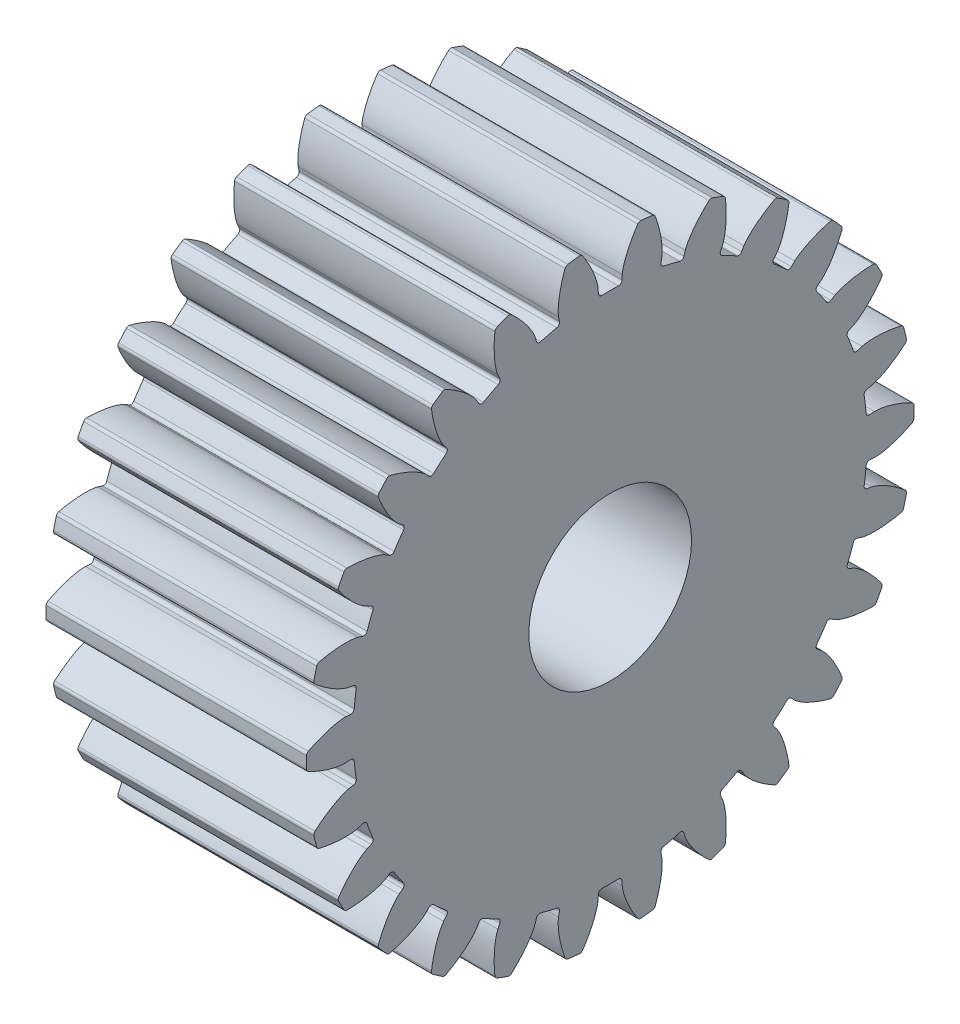
from build123d import *

# Parameters (mm, degrees)
SKETCH2_R                      = 14.816666667
SKETCH2_R_2                    = 3.96875
GEAR_WIDTH_EXTRUDE_DEPTH       = 12.7
GEAR_TOOTH_CUT_DEPTH           = 25.4
TOOTH_FILLETS_R                = 0.166158333
CIRPATTERN1_COUNT              = 26
CIRPATTERN1_COPY_1_DEPTH       = 25.4
CIRPATTERN1_COPY_2_DEPTH       = 25.4
CIRPATTERN1_COPY_3_DEPTH       = 25.4
CIRPATTERN1_COPY_4_DEPTH       = 25.4
CIRPATTERN1_COPY_5_DEPTH       = 25.4
CIRPATTERN1_COPY_6_DEPTH       = 25.4
CIRPATTERN1_COPY_7_DEPTH       = 25.4
CIRPATTERN1_COPY_8_DEPTH       = 25.4
CIRPATTERN1_COPY_9_DEPTH       = 25.4
CIRPATTERN1_COPY_10_DEPTH      = 25.4
CIRPATTERN1_COPY_11_DEPTH      = 25.4
CIRPATTERN1_COPY_12_DEPTH      = 25.4
CIRPATTERN1_COPY_13_DEPTH      = 25.4
CIRPATTERN1_COPY_14_DEPTH      = 25.4
CIRPATTERN1_COPY_15_DEPTH      = 25.4
CIRPATTERN1_COPY_16_DEPTH      = 25.4
CIRPATTERN1_COPY_17_DEPTH      = 25.4
CIRPATTERN1_COPY_18_DEPTH      = 25.4
CIRPATTERN1_COPY_19_DEPTH      = 25.4
CIRPATTERN1_COPY_20_DEPTH      = 25.4
CIRPATTERN1_COPY_21_DEPTH      = 25.4
CIRPATTERN1_COPY_22_DEPTH      = 25.4
CIRPATTERN1_COPY_23_DEPTH      = 25.4
CIRPATTERN1_COPY_24_DEPTH      = 25.4
CIRPATTERN1_COPY_25_DEPTH      = 25.4
TOOTH_FILLETS_OF_CIRPATTERN1_R = 0.166158333


with BuildPart() as part:
    # Sketch2 → Gear Width Extrude (new body)
    with BuildSketch(Plane.YZ):
        Circle(SKETCH2_R)
        Circle(SKETCH2_R_2, mode=Mode.SUBTRACT)
    extrude(amount=GEAR_WIDTH_EXTRUDE_DEPTH)

    # Sketch3 → Gear Tooth Cut (cut)
    with BuildSketch(Plane.YZ):
        with BuildLine():
            ThreePointArc((12.52086362, 0.570229012), (12.530596735, 0.28518834), (12.533841667, 0))
            Line((12.533841667, 0), (14.816666667, 0))
            ThreePointArc((14.816666667, 0), (14.79996166, 0.70338182), (14.749884306, 1.405177589))
            add(Edge.make_bspline(
                [(12.915217508, 0.588188798), (12.918208341, 0.588360522), (12.926591, 0.5889519), (12.952440381, 0.591486174), (13.003294161, 0.598476616), (13.065845165, 0.609963216), (13.137508857, 0.625896967), (13.206422051, 0.64341803), (13.265177715, 0.659725839), (13.323624717, 0.677227502), (13.381691149, 0.695773656), (13.451831714, 0.719550719), (13.535655857, 0.749883796), (13.633192126, 0.787986968), (13.743267873, 0.834322472), (13.854828898, 0.884873112), (13.964077164, 0.937345481), (14.073810457, 0.993489939), (14.179521744, 1.050028375), (14.288612776, 1.111944092), (14.388950715, 1.17071875), (14.500534436, 1.240082235), (14.590344265, 1.297086613), (14.682395145, 1.358891943), (14.72708899, 1.389403312), (14.749884306, 1.405177589)],
                knots=[0, 0, 0, 0, 0, 0.005376749, 0.015083688, 0.04661014, 0.092110526, 0.119476176, 0.146842496, 0.174208854, 0.201574956, 0.228941013, 0.256307345, 0.307035032, 0.361767352, 0.416499661, 0.471231937, 0.525964282, 0.580696616, 0.635428982, 0.690161387, 0.744893688, 0.799626082, 0.854358407, 0.909090914, 0.909090914, 0.909090914, 0.909090914, 0.909090914], degree=4))
            Line((12.915217508, 0.588188798), (12.52086362, 0.570229012))
        make_face()
    gear_tooth_cut = extrude(amount=GEAR_TOOTH_CUT_DEPTH, mode=Mode.SUBTRACT)

    # Gear Tooth Cut Mirror: Gear Tooth Cut across plane
    add(gear_tooth_cut.mirror(Plane(origin=(25.4, 0, 0), x_dir=(1, 0, 0), z_dir=(0, 0, 1))), mode=Mode.SUBTRACT)

    # Tooth Fillets
    tooth_fillets_edges = [part.edges().sort_by_distance(p)[0] for p in [
        (6.35, 14.749884306, 1.405177589),
        (6.35, 14.749884306, -1.405177589),
        (6.35, 12.52086362, 0.570229012),
        (6.35, 12.52086362, -0.570229012),
    ]]
    fillet(tooth_fillets_edges, radius=TOOTH_FILLETS_R)

    # CirPattern1: Gear Tooth Cut ×26 about axis
    cirpattern1_axis = Axis((0, 0, 0), (1, 0, 0))
    for i in range(1, CIRPATTERN1_COUNT):
        add(gear_tooth_cut.rotate(cirpattern1_axis, i * 360 / CIRPATTERN1_COUNT), mode=Mode.SUBTRACT)

    # CirPattern1 copy 1 sketch → CirPattern1 copy 1 (cut)
    with BuildSketch(Plane(origin=(0, 0, 0), x_dir=(0, 0.970941817426052, 0.23931566428755777), z_dir=(1, 0, 0))):
        with BuildLine():
            ThreePointArc((12.52086362, -0.570229012), (12.530596735, -0.28518834), (12.533841667, 0))
            Line((12.533841667, 0), (14.816666667, 0))
            ThreePointArc((14.816666667, 0), (14.79996166, -0.70338182), (14.749884306, -1.405177589))
            add(Edge.make_bspline(
                [(12.915217508, -0.588188798), (12.918208341, -0.588360522), (12.926591, -0.5889519), (12.952440381, -0.591486174), (13.003294161, -0.598476616), (13.065845165, -0.609963216), (13.137508857, -0.625896967), (13.206422051, -0.64341803), (13.265177715, -0.659725839), (13.323624717, -0.677227502), (13.381691149, -0.695773656), (13.451831714, -0.719550719), (13.535655857, -0.749883796), (13.633192126, -0.787986968), (13.743267873, -0.834322472), (13.854828898, -0.884873112), (13.964077164, -0.937345481), (14.073810457, -0.993489939), (14.179521744, -1.050028375), (14.288612776, -1.111944092), (14.388950715, -1.17071875), (14.500534436, -1.240082235), (14.590344265, -1.297086613), (14.682395145, -1.358891943), (14.72708899, -1.389403312), (14.749884306, -1.405177589)],
                knots=[0, 0, 0, 0, 0, 0.005376749, 0.015083688, 0.04661014, 0.092110526, 0.119476176, 0.146842496, 0.174208854, 0.201574956, 0.228941013, 0.256307345, 0.307035032, 0.361767352, 0.416499661, 0.471231937, 0.525964282, 0.580696616, 0.635428982, 0.690161387, 0.744893688, 0.799626082, 0.854358407, 0.909090914, 0.909090914, 0.909090914, 0.909090914, 0.909090914], degree=4))
            Line((12.915217508, -0.588188798), (12.52086362, -0.570229012))
        make_face()
    extrude(amount=CIRPATTERN1_COPY_1_DEPTH, mode=Mode.SUBTRACT)

    # CirPattern1 copy 2 sketch → CirPattern1 copy 2 (cut)
    with BuildSketch(Plane(origin=(0, 0, 0), x_dir=(0, 0.8854560256532099, 0.46472317204376856), z_dir=(1, 0, 0))):
        with BuildLine():
            ThreePointArc((12.52086362, -0.570229012), (12.530596735, -0.28518834), (12.533841667, 0))
            Line((12.533841667, 0), (14.816666667, 0))
            ThreePointArc((14.816666667, 0), (14.79996166, -0.70338182), (14.749884306, -1.405177589))
            add(Edge.make_bspline(
                [(12.915217508, -0.588188798), (12.918208341, -0.588360522), (12.926591, -0.5889519), (12.952440381, -0.591486174), (13.003294161, -0.598476616), (13.065845165, -0.609963216), (13.137508857, -0.625896967), (13.206422051, -0.64341803), (13.265177715, -0.659725839), (13.323624717, -0.677227502), (13.381691149, -0.695773656), (13.451831714, -0.719550719), (13.535655857, -0.749883796), (13.633192126, -0.787986968), (13.743267873, -0.834322472), (13.854828898, -0.884873112), (13.964077164, -0.937345481), (14.073810457, -0.993489939), (14.179521744, -1.050028375), (14.288612776, -1.111944092), (14.388950715, -1.17071875), (14.500534436, -1.240082235), (14.590344265, -1.297086613), (14.682395145, -1.358891943), (14.72708899, -1.389403312), (14.749884306, -1.405177589)],
                knots=[0, 0, 0, 0, 0, 0.005376749, 0.015083688, 0.04661014, 0.092110526, 0.119476176, 0.146842496, 0.174208854, 0.201574956, 0.228941013, 0.256307345, 0.307035032, 0.361767352, 0.416499661, 0.471231937, 0.525964282, 0.580696616, 0.635428982, 0.690161387, 0.744893688, 0.799626082, 0.854358407, 0.909090914, 0.909090914, 0.909090914, 0.909090914, 0.909090914], degree=4))
            Line((12.915217508, -0.588188798), (12.52086362, -0.570229012))
        make_face()
    extrude(amount=CIRPATTERN1_COPY_2_DEPTH, mode=Mode.SUBTRACT)

    # CirPattern1 copy 3 sketch → CirPattern1 copy 3 (cut)
    with BuildSketch(Plane(origin=(0, 0, 0), x_dir=(0, 0.7485107481711011, 0.6631226582407952), z_dir=(1, 0, 0))):
        with BuildLine():
            ThreePointArc((12.52086362, -0.570229012), (12.530596735, -0.28518834), (12.533841667, 0))
            Line((12.533841667, 0), (14.816666667, 0))
            ThreePointArc((14.816666667, 0), (14.79996166, -0.70338182), (14.749884306, -1.405177589))
            add(Edge.make_bspline(
                [(12.915217508, -0.588188798), (12.918208341, -0.588360522), (12.926591, -0.5889519), (12.952440381, -0.591486174), (13.003294161, -0.598476616), (13.065845165, -0.609963216), (13.137508857, -0.625896967), (13.206422051, -0.64341803), (13.265177715, -0.659725839), (13.323624717, -0.677227502), (13.381691149, -0.695773656), (13.451831714, -0.719550719), (13.535655857, -0.749883796), (13.633192126, -0.787986968), (13.743267873, -0.834322472), (13.854828898, -0.884873112), (13.964077164, -0.937345481), (14.073810457, -0.993489939), (14.179521744, -1.050028375), (14.288612776, -1.111944092), (14.388950715, -1.17071875), (14.500534436, -1.240082235), (14.590344265, -1.297086613), (14.682395145, -1.358891943), (14.72708899, -1.389403312), (14.749884306, -1.405177589)],
                knots=[0, 0, 0, 0, 0, 0.005376749, 0.015083688, 0.04661014, 0.092110526, 0.119476176, 0.146842496, 0.174208854, 0.201574956, 0.228941013, 0.256307345, 0.307035032, 0.361767352, 0.416499661, 0.471231937, 0.525964282, 0.580696616, 0.635428982, 0.690161387, 0.744893688, 0.799626082, 0.854358407, 0.909090914, 0.909090914, 0.909090914, 0.909090914, 0.909090914], degree=4))
            Line((12.915217508, -0.588188798), (12.52086362, -0.570229012))
        make_face()
    extrude(amount=CIRPATTERN1_COPY_3_DEPTH, mode=Mode.SUBTRACT)

    # CirPattern1 copy 4 sketch → CirPattern1 copy 4 (cut)
    with BuildSketch(Plane(origin=(0, 0, 0), x_dir=(0, 0.5680647467311558, 0.8229838658936565), z_dir=(1, 0, 0))):
        with BuildLine():
            ThreePointArc((12.52086362, -0.570229012), (12.530596735, -0.28518834), (12.533841667, 0))
            Line((12.533841667, 0), (14.816666667, 0))
            ThreePointArc((14.816666667, 0), (14.79996166, -0.70338182), (14.749884306, -1.405177589))
            add(Edge.make_bspline(
                [(12.915217508, -0.588188798), (12.918208341, -0.588360522), (12.926591, -0.5889519), (12.952440381, -0.591486174), (13.003294161, -0.598476616), (13.065845165, -0.609963216), (13.137508857, -0.625896967), (13.206422051, -0.64341803), (13.265177715, -0.659725839), (13.323624717, -0.677227502), (13.381691149, -0.695773656), (13.451831714, -0.719550719), (13.535655857, -0.749883796), (13.633192126, -0.787986968), (13.743267873, -0.834322472), (13.854828898, -0.884873112), (13.964077164, -0.937345481), (14.073810457, -0.993489939), (14.179521744, -1.050028375), (14.288612776, -1.111944092), (14.388950715, -1.17071875), (14.500534436, -1.240082235), (14.590344265, -1.297086613), (14.682395145, -1.358891943), (14.72708899, -1.389403312), (14.749884306, -1.405177589)],
                knots=[0, 0, 0, 0, 0, 0.005376749, 0.015083688, 0.04661014, 0.092110526, 0.119476176, 0.146842496, 0.174208854, 0.201574956, 0.228941013, 0.256307345, 0.307035032, 0.361767352, 0.416499661, 0.471231937, 0.525964282, 0.580696616, 0.635428982, 0.690161387, 0.744893688, 0.799626082, 0.854358407, 0.909090914, 0.909090914, 0.909090914, 0.909090914, 0.909090914], degree=4))
            Line((12.915217508, -0.588188798), (12.52086362, -0.570229012))
        make_face()
    extrude(amount=CIRPATTERN1_COPY_4_DEPTH, mode=Mode.SUBTRACT)

    # CirPattern1 copy 5 sketch → CirPattern1 copy 5 (cut)
    with BuildSketch(Plane(origin=(0, 0, 0), x_dir=(0, 0.3546048870425358, 0.9350162426854147), z_dir=(1, 0, 0))):
        with BuildLine():
            ThreePointArc((12.52086362, -0.570229012), (12.530596735, -0.28518834), (12.533841667, 0))
            Line((12.533841667, 0), (14.816666667, 0))
            ThreePointArc((14.816666667, 0), (14.79996166, -0.70338182), (14.749884306, -1.405177589))
            add(Edge.make_bspline(
                [(12.915217508, -0.588188798), (12.918208341, -0.588360522), (12.926591, -0.5889519), (12.952440381, -0.591486174), (13.003294161, -0.598476616), (13.065845165, -0.609963216), (13.137508857, -0.625896967), (13.206422051, -0.64341803), (13.265177715, -0.659725839), (13.323624717, -0.677227502), (13.381691149, -0.695773656), (13.451831714, -0.719550719), (13.535655857, -0.749883796), (13.633192126, -0.787986968), (13.743267873, -0.834322472), (13.854828898, -0.884873112), (13.964077164, -0.937345481), (14.073810457, -0.993489939), (14.179521744, -1.050028375), (14.288612776, -1.111944092), (14.388950715, -1.17071875), (14.500534436, -1.240082235), (14.590344265, -1.297086613), (14.682395145, -1.358891943), (14.72708899, -1.389403312), (14.749884306, -1.405177589)],
                knots=[0, 0, 0, 0, 0, 0.005376749, 0.015083688, 0.04661014, 0.092110526, 0.119476176, 0.146842496, 0.174208854, 0.201574956, 0.228941013, 0.256307345, 0.307035032, 0.361767352, 0.416499661, 0.471231937, 0.525964282, 0.580696616, 0.635428982, 0.690161387, 0.744893688, 0.799626082, 0.854358407, 0.909090914, 0.909090914, 0.909090914, 0.909090914, 0.909090914], degree=4))
            Line((12.915217508, -0.588188798), (12.52086362, -0.570229012))
        make_face()
    extrude(amount=CIRPATTERN1_COPY_5_DEPTH, mode=Mode.SUBTRACT)

    # CirPattern1 copy 6 sketch → CirPattern1 copy 6 (cut)
    with BuildSketch(Plane(origin=(0, 0, 0), x_dir=(0, 0.120536680255323, 0.992708874098054), z_dir=(1, 0, 0))):
        with BuildLine():
            ThreePointArc((12.52086362, -0.570229012), (12.530596735, -0.28518834), (12.533841667, 0))
            Line((12.533841667, 0), (14.816666667, 0))
            ThreePointArc((14.816666667, 0), (14.79996166, -0.70338182), (14.749884306, -1.405177589))
            add(Edge.make_bspline(
                [(12.915217508, -0.588188798), (12.918208341, -0.588360522), (12.926591, -0.5889519), (12.952440381, -0.591486174), (13.003294161, -0.598476616), (13.065845165, -0.609963216), (13.137508857, -0.625896967), (13.206422051, -0.64341803), (13.265177715, -0.659725839), (13.323624717, -0.677227502), (13.381691149, -0.695773656), (13.451831714, -0.719550719), (13.535655857, -0.749883796), (13.633192126, -0.787986968), (13.743267873, -0.834322472), (13.854828898, -0.884873112), (13.964077164, -0.937345481), (14.073810457, -0.993489939), (14.179521744, -1.050028375), (14.288612776, -1.111944092), (14.388950715, -1.17071875), (14.500534436, -1.240082235), (14.590344265, -1.297086613), (14.682395145, -1.358891943), (14.72708899, -1.389403312), (14.749884306, -1.405177589)],
                knots=[0, 0, 0, 0, 0, 0.005376749, 0.015083688, 0.04661014, 0.092110526, 0.119476176, 0.146842496, 0.174208854, 0.201574956, 0.228941013, 0.256307345, 0.307035032, 0.361767352, 0.416499661, 0.471231937, 0.525964282, 0.580696616, 0.635428982, 0.690161387, 0.744893688, 0.799626082, 0.854358407, 0.909090914, 0.909090914, 0.909090914, 0.909090914, 0.909090914], degree=4))
            Line((12.915217508, -0.588188798), (12.52086362, -0.570229012))
        make_face()
    extrude(amount=CIRPATTERN1_COPY_6_DEPTH, mode=Mode.SUBTRACT)

    # CirPattern1 copy 7 sketch → CirPattern1 copy 7 (cut)
    with BuildSketch(Plane(origin=(0, 0, 0), x_dir=(0, -0.1205366802553231, 0.992708874098054), z_dir=(1, 0, 0))):
        with BuildLine():
            ThreePointArc((12.52086362, -0.570229012), (12.530596735, -0.28518834), (12.533841667, 0))
            Line((12.533841667, 0), (14.816666667, 0))
            ThreePointArc((14.816666667, 0), (14.79996166, -0.70338182), (14.749884306, -1.405177589))
            add(Edge.make_bspline(
                [(12.915217508, -0.588188798), (12.918208341, -0.588360522), (12.926591, -0.5889519), (12.952440381, -0.591486174), (13.003294161, -0.598476616), (13.065845165, -0.609963216), (13.137508857, -0.625896967), (13.206422051, -0.64341803), (13.265177715, -0.659725839), (13.323624717, -0.677227502), (13.381691149, -0.695773656), (13.451831714, -0.719550719), (13.535655857, -0.749883796), (13.633192126, -0.787986968), (13.743267873, -0.834322472), (13.854828898, -0.884873112), (13.964077164, -0.937345481), (14.073810457, -0.993489939), (14.179521744, -1.050028375), (14.288612776, -1.111944092), (14.388950715, -1.17071875), (14.500534436, -1.240082235), (14.590344265, -1.297086613), (14.682395145, -1.358891943), (14.72708899, -1.389403312), (14.749884306, -1.405177589)],
                knots=[0, 0, 0, 0, 0, 0.005376749, 0.015083688, 0.04661014, 0.092110526, 0.119476176, 0.146842496, 0.174208854, 0.201574956, 0.228941013, 0.256307345, 0.307035032, 0.361767352, 0.416499661, 0.471231937, 0.525964282, 0.580696616, 0.635428982, 0.690161387, 0.744893688, 0.799626082, 0.854358407, 0.909090914, 0.909090914, 0.909090914, 0.909090914, 0.909090914], degree=4))
            Line((12.915217508, -0.588188798), (12.52086362, -0.570229012))
        make_face()
    extrude(amount=CIRPATTERN1_COPY_7_DEPTH, mode=Mode.SUBTRACT)

    # CirPattern1 copy 8 sketch → CirPattern1 copy 8 (cut)
    with BuildSketch(Plane(origin=(0, 0, 0), x_dir=(0, -0.3546048870425357, 0.9350162426854148), z_dir=(1, 0, 0))):
        with BuildLine():
            ThreePointArc((12.52086362, -0.570229012), (12.530596735, -0.28518834), (12.533841667, 0))
            Line((12.533841667, 0), (14.816666667, 0))
            ThreePointArc((14.816666667, 0), (14.79996166, -0.70338182), (14.749884306, -1.405177589))
            add(Edge.make_bspline(
                [(12.915217508, -0.588188798), (12.918208341, -0.588360522), (12.926591, -0.5889519), (12.952440381, -0.591486174), (13.003294161, -0.598476616), (13.065845165, -0.609963216), (13.137508857, -0.625896967), (13.206422051, -0.64341803), (13.265177715, -0.659725839), (13.323624717, -0.677227502), (13.381691149, -0.695773656), (13.451831714, -0.719550719), (13.535655857, -0.749883796), (13.633192126, -0.787986968), (13.743267873, -0.834322472), (13.854828898, -0.884873112), (13.964077164, -0.937345481), (14.073810457, -0.993489939), (14.179521744, -1.050028375), (14.288612776, -1.111944092), (14.388950715, -1.17071875), (14.500534436, -1.240082235), (14.590344265, -1.297086613), (14.682395145, -1.358891943), (14.72708899, -1.389403312), (14.749884306, -1.405177589)],
                knots=[0, 0, 0, 0, 0, 0.005376749, 0.015083688, 0.04661014, 0.092110526, 0.119476176, 0.146842496, 0.174208854, 0.201574956, 0.228941013, 0.256307345, 0.307035032, 0.361767352, 0.416499661, 0.471231937, 0.525964282, 0.580696616, 0.635428982, 0.690161387, 0.744893688, 0.799626082, 0.854358407, 0.909090914, 0.909090914, 0.909090914, 0.909090914, 0.909090914], degree=4))
            Line((12.915217508, -0.588188798), (12.52086362, -0.570229012))
        make_face()
    extrude(amount=CIRPATTERN1_COPY_8_DEPTH, mode=Mode.SUBTRACT)

    # CirPattern1 copy 9 sketch → CirPattern1 copy 9 (cut)
    with BuildSketch(Plane(origin=(0, 0, 0), x_dir=(0, -0.5680647467311557, 0.8229838658936565), z_dir=(1, 0, 0))):
        with BuildLine():
            ThreePointArc((12.52086362, -0.570229012), (12.530596735, -0.28518834), (12.533841667, 0))
            Line((12.533841667, 0), (14.816666667, 0))
            ThreePointArc((14.816666667, 0), (14.79996166, -0.70338182), (14.749884306, -1.405177589))
            add(Edge.make_bspline(
                [(12.915217508, -0.588188798), (12.918208341, -0.588360522), (12.926591, -0.5889519), (12.952440381, -0.591486174), (13.003294161, -0.598476616), (13.065845165, -0.609963216), (13.137508857, -0.625896967), (13.206422051, -0.64341803), (13.265177715, -0.659725839), (13.323624717, -0.677227502), (13.381691149, -0.695773656), (13.451831714, -0.719550719), (13.535655857, -0.749883796), (13.633192126, -0.787986968), (13.743267873, -0.834322472), (13.854828898, -0.884873112), (13.964077164, -0.937345481), (14.073810457, -0.993489939), (14.179521744, -1.050028375), (14.288612776, -1.111944092), (14.388950715, -1.17071875), (14.500534436, -1.240082235), (14.590344265, -1.297086613), (14.682395145, -1.358891943), (14.72708899, -1.389403312), (14.749884306, -1.405177589)],
                knots=[0, 0, 0, 0, 0, 0.005376749, 0.015083688, 0.04661014, 0.092110526, 0.119476176, 0.146842496, 0.174208854, 0.201574956, 0.228941013, 0.256307345, 0.307035032, 0.361767352, 0.416499661, 0.471231937, 0.525964282, 0.580696616, 0.635428982, 0.690161387, 0.744893688, 0.799626082, 0.854358407, 0.909090914, 0.909090914, 0.909090914, 0.909090914, 0.909090914], degree=4))
            Line((12.915217508, -0.588188798), (12.52086362, -0.570229012))
        make_face()
    extrude(amount=CIRPATTERN1_COPY_9_DEPTH, mode=Mode.SUBTRACT)

    # CirPattern1 copy 10 sketch → CirPattern1 copy 10 (cut)
    with BuildSketch(Plane(origin=(0, 0, 0), x_dir=(0, -0.7485107481711009, 0.6631226582407955), z_dir=(1, 0, 0))):
        with BuildLine():
            ThreePointArc((12.52086362, -0.570229012), (12.530596735, -0.28518834), (12.533841667, 0))
            Line((12.533841667, 0), (14.816666667, 0))
            ThreePointArc((14.816666667, 0), (14.79996166, -0.70338182), (14.749884306, -1.405177589))
            add(Edge.make_bspline(
                [(12.915217508, -0.588188798), (12.918208341, -0.588360522), (12.926591, -0.5889519), (12.952440381, -0.591486174), (13.003294161, -0.598476616), (13.065845165, -0.609963216), (13.137508857, -0.625896967), (13.206422051, -0.64341803), (13.265177715, -0.659725839), (13.323624717, -0.677227502), (13.381691149, -0.695773656), (13.451831714, -0.719550719), (13.535655857, -0.749883796), (13.633192126, -0.787986968), (13.743267873, -0.834322472), (13.854828898, -0.884873112), (13.964077164, -0.937345481), (14.073810457, -0.993489939), (14.179521744, -1.050028375), (14.288612776, -1.111944092), (14.388950715, -1.17071875), (14.500534436, -1.240082235), (14.590344265, -1.297086613), (14.682395145, -1.358891943), (14.72708899, -1.389403312), (14.749884306, -1.405177589)],
                knots=[0, 0, 0, 0, 0, 0.005376749, 0.015083688, 0.04661014, 0.092110526, 0.119476176, 0.146842496, 0.174208854, 0.201574956, 0.228941013, 0.256307345, 0.307035032, 0.361767352, 0.416499661, 0.471231937, 0.525964282, 0.580696616, 0.635428982, 0.690161387, 0.744893688, 0.799626082, 0.854358407, 0.909090914, 0.909090914, 0.909090914, 0.909090914, 0.909090914], degree=4))
            Line((12.915217508, -0.588188798), (12.52086362, -0.570229012))
        make_face()
    extrude(amount=CIRPATTERN1_COPY_10_DEPTH, mode=Mode.SUBTRACT)

    # CirPattern1 copy 11 sketch → CirPattern1 copy 11 (cut)
    with BuildSketch(Plane(origin=(0, 0, 0), x_dir=(0, -0.88545602565321, 0.4647231720437683), z_dir=(1, 0, 0))):
        with BuildLine():
            ThreePointArc((12.52086362, -0.570229012), (12.530596735, -0.28518834), (12.533841667, 0))
            Line((12.533841667, 0), (14.816666667, 0))
            ThreePointArc((14.816666667, 0), (14.79996166, -0.70338182), (14.749884306, -1.405177589))
            add(Edge.make_bspline(
                [(12.915217508, -0.588188798), (12.918208341, -0.588360522), (12.926591, -0.5889519), (12.952440381, -0.591486174), (13.003294161, -0.598476616), (13.065845165, -0.609963216), (13.137508857, -0.625896967), (13.206422051, -0.64341803), (13.265177715, -0.659725839), (13.323624717, -0.677227502), (13.381691149, -0.695773656), (13.451831714, -0.719550719), (13.535655857, -0.749883796), (13.633192126, -0.787986968), (13.743267873, -0.834322472), (13.854828898, -0.884873112), (13.964077164, -0.937345481), (14.073810457, -0.993489939), (14.179521744, -1.050028375), (14.288612776, -1.111944092), (14.388950715, -1.17071875), (14.500534436, -1.240082235), (14.590344265, -1.297086613), (14.682395145, -1.358891943), (14.72708899, -1.389403312), (14.749884306, -1.405177589)],
                knots=[0, 0, 0, 0, 0, 0.005376749, 0.015083688, 0.04661014, 0.092110526, 0.119476176, 0.146842496, 0.174208854, 0.201574956, 0.228941013, 0.256307345, 0.307035032, 0.361767352, 0.416499661, 0.471231937, 0.525964282, 0.580696616, 0.635428982, 0.690161387, 0.744893688, 0.799626082, 0.854358407, 0.909090914, 0.909090914, 0.909090914, 0.909090914, 0.909090914], degree=4))
            Line((12.915217508, -0.588188798), (12.52086362, -0.570229012))
        make_face()
    extrude(amount=CIRPATTERN1_COPY_11_DEPTH, mode=Mode.SUBTRACT)

    # CirPattern1 copy 12 sketch → CirPattern1 copy 12 (cut)
    with BuildSketch(Plane(origin=(0, 0, 0), x_dir=(0, -0.970941817426052, 0.23931566428755768), z_dir=(1, 0, 0))):
        with BuildLine():
            ThreePointArc((12.52086362, -0.570229012), (12.530596735, -0.28518834), (12.533841667, 0))
            Line((12.533841667, 0), (14.816666667, 0))
            ThreePointArc((14.816666667, 0), (14.79996166, -0.70338182), (14.749884306, -1.405177589))
            add(Edge.make_bspline(
                [(12.915217508, -0.588188798), (12.918208341, -0.588360522), (12.926591, -0.5889519), (12.952440381, -0.591486174), (13.003294161, -0.598476616), (13.065845165, -0.609963216), (13.137508857, -0.625896967), (13.206422051, -0.64341803), (13.265177715, -0.659725839), (13.323624717, -0.677227502), (13.381691149, -0.695773656), (13.451831714, -0.719550719), (13.535655857, -0.749883796), (13.633192126, -0.787986968), (13.743267873, -0.834322472), (13.854828898, -0.884873112), (13.964077164, -0.937345481), (14.073810457, -0.993489939), (14.179521744, -1.050028375), (14.288612776, -1.111944092), (14.388950715, -1.17071875), (14.500534436, -1.240082235), (14.590344265, -1.297086613), (14.682395145, -1.358891943), (14.72708899, -1.389403312), (14.749884306, -1.405177589)],
                knots=[0, 0, 0, 0, 0, 0.005376749, 0.015083688, 0.04661014, 0.092110526, 0.119476176, 0.146842496, 0.174208854, 0.201574956, 0.228941013, 0.256307345, 0.307035032, 0.361767352, 0.416499661, 0.471231937, 0.525964282, 0.580696616, 0.635428982, 0.690161387, 0.744893688, 0.799626082, 0.854358407, 0.909090914, 0.909090914, 0.909090914, 0.909090914, 0.909090914], degree=4))
            Line((12.915217508, -0.588188798), (12.52086362, -0.570229012))
        make_face()
    extrude(amount=CIRPATTERN1_COPY_12_DEPTH, mode=Mode.SUBTRACT)

    # CirPattern1 copy 13 sketch → CirPattern1 copy 13 (cut)
    with BuildSketch(Plane(origin=(0, 0, 0), x_dir=(0, -1, 0), z_dir=(1, 0, 0))):
        with BuildLine():
            ThreePointArc((12.52086362, -0.570229012), (12.530596735, -0.28518834), (12.533841667, 0))
            Line((12.533841667, 0), (14.816666667, 0))
            ThreePointArc((14.816666667, 0), (14.79996166, -0.70338182), (14.749884306, -1.405177589))
            add(Edge.make_bspline(
                [(12.915217508, -0.588188798), (12.918208341, -0.588360522), (12.926591, -0.5889519), (12.952440381, -0.591486174), (13.003294161, -0.598476616), (13.065845165, -0.609963216), (13.137508857, -0.625896967), (13.206422051, -0.64341803), (13.265177715, -0.659725839), (13.323624717, -0.677227502), (13.381691149, -0.695773656), (13.451831714, -0.719550719), (13.535655857, -0.749883796), (13.633192126, -0.787986968), (13.743267873, -0.834322472), (13.854828898, -0.884873112), (13.964077164, -0.937345481), (14.073810457, -0.993489939), (14.179521744, -1.050028375), (14.288612776, -1.111944092), (14.388950715, -1.17071875), (14.500534436, -1.240082235), (14.590344265, -1.297086613), (14.682395145, -1.358891943), (14.72708899, -1.389403312), (14.749884306, -1.405177589)],
                knots=[0, 0, 0, 0, 0, 0.005376749, 0.015083688, 0.04661014, 0.092110526, 0.119476176, 0.146842496, 0.174208854, 0.201574956, 0.228941013, 0.256307345, 0.307035032, 0.361767352, 0.416499661, 0.471231937, 0.525964282, 0.580696616, 0.635428982, 0.690161387, 0.744893688, 0.799626082, 0.854358407, 0.909090914, 0.909090914, 0.909090914, 0.909090914, 0.909090914], degree=4))
            Line((12.915217508, -0.588188798), (12.52086362, -0.570229012))
        make_face()
    extrude(amount=CIRPATTERN1_COPY_13_DEPTH, mode=Mode.SUBTRACT)

    # CirPattern1 copy 14 sketch → CirPattern1 copy 14 (cut)
    with BuildSketch(Plane(origin=(0, 0, 0), x_dir=(0, -0.970941817426052, -0.23931566428755788), z_dir=(1, 0, 0))):
        with BuildLine():
            ThreePointArc((12.52086362, -0.570229012), (12.530596735, -0.28518834), (12.533841667, 0))
            Line((12.533841667, 0), (14.816666667, 0))
            ThreePointArc((14.816666667, 0), (14.79996166, -0.70338182), (14.749884306, -1.405177589))
            add(Edge.make_bspline(
                [(12.915217508, -0.588188798), (12.918208341, -0.588360522), (12.926591, -0.5889519), (12.952440381, -0.591486174), (13.003294161, -0.598476616), (13.065845165, -0.609963216), (13.137508857, -0.625896967), (13.206422051, -0.64341803), (13.265177715, -0.659725839), (13.323624717, -0.677227502), (13.381691149, -0.695773656), (13.451831714, -0.719550719), (13.535655857, -0.749883796), (13.633192126, -0.787986968), (13.743267873, -0.834322472), (13.854828898, -0.884873112), (13.964077164, -0.937345481), (14.073810457, -0.993489939), (14.179521744, -1.050028375), (14.288612776, -1.111944092), (14.388950715, -1.17071875), (14.500534436, -1.240082235), (14.590344265, -1.297086613), (14.682395145, -1.358891943), (14.72708899, -1.389403312), (14.749884306, -1.405177589)],
                knots=[0, 0, 0, 0, 0, 0.005376749, 0.015083688, 0.04661014, 0.092110526, 0.119476176, 0.146842496, 0.174208854, 0.201574956, 0.228941013, 0.256307345, 0.307035032, 0.361767352, 0.416499661, 0.471231937, 0.525964282, 0.580696616, 0.635428982, 0.690161387, 0.744893688, 0.799626082, 0.854358407, 0.909090914, 0.909090914, 0.909090914, 0.909090914, 0.909090914], degree=4))
            Line((12.915217508, -0.588188798), (12.52086362, -0.570229012))
        make_face()
    extrude(amount=CIRPATTERN1_COPY_14_DEPTH, mode=Mode.SUBTRACT)

    # CirPattern1 copy 15 sketch → CirPattern1 copy 15 (cut)
    with BuildSketch(Plane(origin=(0, 0, 0), x_dir=(0, -0.8854560256532097, -0.46472317204376884), z_dir=(1, 0, 0))):
        with BuildLine():
            ThreePointArc((12.52086362, -0.570229012), (12.530596735, -0.28518834), (12.533841667, 0))
            Line((12.533841667, 0), (14.816666667, 0))
            ThreePointArc((14.816666667, 0), (14.79996166, -0.70338182), (14.749884306, -1.405177589))
            add(Edge.make_bspline(
                [(12.915217508, -0.588188798), (12.918208341, -0.588360522), (12.926591, -0.5889519), (12.952440381, -0.591486174), (13.003294161, -0.598476616), (13.065845165, -0.609963216), (13.137508857, -0.625896967), (13.206422051, -0.64341803), (13.265177715, -0.659725839), (13.323624717, -0.677227502), (13.381691149, -0.695773656), (13.451831714, -0.719550719), (13.535655857, -0.749883796), (13.633192126, -0.787986968), (13.743267873, -0.834322472), (13.854828898, -0.884873112), (13.964077164, -0.937345481), (14.073810457, -0.993489939), (14.179521744, -1.050028375), (14.288612776, -1.111944092), (14.388950715, -1.17071875), (14.500534436, -1.240082235), (14.590344265, -1.297086613), (14.682395145, -1.358891943), (14.72708899, -1.389403312), (14.749884306, -1.405177589)],
                knots=[0, 0, 0, 0, 0, 0.005376749, 0.015083688, 0.04661014, 0.092110526, 0.119476176, 0.146842496, 0.174208854, 0.201574956, 0.228941013, 0.256307345, 0.307035032, 0.361767352, 0.416499661, 0.471231937, 0.525964282, 0.580696616, 0.635428982, 0.690161387, 0.744893688, 0.799626082, 0.854358407, 0.909090914, 0.909090914, 0.909090914, 0.909090914, 0.909090914], degree=4))
            Line((12.915217508, -0.588188798), (12.52086362, -0.570229012))
        make_face()
    extrude(amount=CIRPATTERN1_COPY_15_DEPTH, mode=Mode.SUBTRACT)

    # CirPattern1 copy 16 sketch → CirPattern1 copy 16 (cut)
    with BuildSketch(Plane(origin=(0, 0, 0), x_dir=(0, -0.748510748171101, -0.6631226582407953), z_dir=(1, 0, 0))):
        with BuildLine():
            ThreePointArc((12.52086362, -0.570229012), (12.530596735, -0.28518834), (12.533841667, 0))
            Line((12.533841667, 0), (14.816666667, 0))
            ThreePointArc((14.816666667, 0), (14.79996166, -0.70338182), (14.749884306, -1.405177589))
            add(Edge.make_bspline(
                [(12.915217508, -0.588188798), (12.918208341, -0.588360522), (12.926591, -0.5889519), (12.952440381, -0.591486174), (13.003294161, -0.598476616), (13.065845165, -0.609963216), (13.137508857, -0.625896967), (13.206422051, -0.64341803), (13.265177715, -0.659725839), (13.323624717, -0.677227502), (13.381691149, -0.695773656), (13.451831714, -0.719550719), (13.535655857, -0.749883796), (13.633192126, -0.787986968), (13.743267873, -0.834322472), (13.854828898, -0.884873112), (13.964077164, -0.937345481), (14.073810457, -0.993489939), (14.179521744, -1.050028375), (14.288612776, -1.111944092), (14.388950715, -1.17071875), (14.500534436, -1.240082235), (14.590344265, -1.297086613), (14.682395145, -1.358891943), (14.72708899, -1.389403312), (14.749884306, -1.405177589)],
                knots=[0, 0, 0, 0, 0, 0.005376749, 0.015083688, 0.04661014, 0.092110526, 0.119476176, 0.146842496, 0.174208854, 0.201574956, 0.228941013, 0.256307345, 0.307035032, 0.361767352, 0.416499661, 0.471231937, 0.525964282, 0.580696616, 0.635428982, 0.690161387, 0.744893688, 0.799626082, 0.854358407, 0.909090914, 0.909090914, 0.909090914, 0.909090914, 0.909090914], degree=4))
            Line((12.915217508, -0.588188798), (12.52086362, -0.570229012))
        make_face()
    extrude(amount=CIRPATTERN1_COPY_16_DEPTH, mode=Mode.SUBTRACT)

    # CirPattern1 copy 17 sketch → CirPattern1 copy 17 (cut)
    with BuildSketch(Plane(origin=(0, 0, 0), x_dir=(0, -0.5680647467311559, -0.8229838658936564), z_dir=(1, 0, 0))):
        with BuildLine():
            ThreePointArc((12.52086362, -0.570229012), (12.530596735, -0.28518834), (12.533841667, 0))
            Line((12.533841667, 0), (14.816666667, 0))
            ThreePointArc((14.816666667, 0), (14.79996166, -0.70338182), (14.749884306, -1.405177589))
            add(Edge.make_bspline(
                [(12.915217508, -0.588188798), (12.918208341, -0.588360522), (12.926591, -0.5889519), (12.952440381, -0.591486174), (13.003294161, -0.598476616), (13.065845165, -0.609963216), (13.137508857, -0.625896967), (13.206422051, -0.64341803), (13.265177715, -0.659725839), (13.323624717, -0.677227502), (13.381691149, -0.695773656), (13.451831714, -0.719550719), (13.535655857, -0.749883796), (13.633192126, -0.787986968), (13.743267873, -0.834322472), (13.854828898, -0.884873112), (13.964077164, -0.937345481), (14.073810457, -0.993489939), (14.179521744, -1.050028375), (14.288612776, -1.111944092), (14.388950715, -1.17071875), (14.500534436, -1.240082235), (14.590344265, -1.297086613), (14.682395145, -1.358891943), (14.72708899, -1.389403312), (14.749884306, -1.405177589)],
                knots=[0, 0, 0, 0, 0, 0.005376749, 0.015083688, 0.04661014, 0.092110526, 0.119476176, 0.146842496, 0.174208854, 0.201574956, 0.228941013, 0.256307345, 0.307035032, 0.361767352, 0.416499661, 0.471231937, 0.525964282, 0.580696616, 0.635428982, 0.690161387, 0.744893688, 0.799626082, 0.854358407, 0.909090914, 0.909090914, 0.909090914, 0.909090914, 0.909090914], degree=4))
            Line((12.915217508, -0.588188798), (12.52086362, -0.570229012))
        make_face()
    extrude(amount=CIRPATTERN1_COPY_17_DEPTH, mode=Mode.SUBTRACT)

    # CirPattern1 copy 18 sketch → CirPattern1 copy 18 (cut)
    with BuildSketch(Plane(origin=(0, 0, 0), x_dir=(0, -0.3546048870425359, -0.9350162426854147), z_dir=(1, 0, 0))):
        with BuildLine():
            ThreePointArc((12.52086362, -0.570229012), (12.530596735, -0.28518834), (12.533841667, 0))
            Line((12.533841667, 0), (14.816666667, 0))
            ThreePointArc((14.816666667, 0), (14.79996166, -0.70338182), (14.749884306, -1.405177589))
            add(Edge.make_bspline(
                [(12.915217508, -0.588188798), (12.918208341, -0.588360522), (12.926591, -0.5889519), (12.952440381, -0.591486174), (13.003294161, -0.598476616), (13.065845165, -0.609963216), (13.137508857, -0.625896967), (13.206422051, -0.64341803), (13.265177715, -0.659725839), (13.323624717, -0.677227502), (13.381691149, -0.695773656), (13.451831714, -0.719550719), (13.535655857, -0.749883796), (13.633192126, -0.787986968), (13.743267873, -0.834322472), (13.854828898, -0.884873112), (13.964077164, -0.937345481), (14.073810457, -0.993489939), (14.179521744, -1.050028375), (14.288612776, -1.111944092), (14.388950715, -1.17071875), (14.500534436, -1.240082235), (14.590344265, -1.297086613), (14.682395145, -1.358891943), (14.72708899, -1.389403312), (14.749884306, -1.405177589)],
                knots=[0, 0, 0, 0, 0, 0.005376749, 0.015083688, 0.04661014, 0.092110526, 0.119476176, 0.146842496, 0.174208854, 0.201574956, 0.228941013, 0.256307345, 0.307035032, 0.361767352, 0.416499661, 0.471231937, 0.525964282, 0.580696616, 0.635428982, 0.690161387, 0.744893688, 0.799626082, 0.854358407, 0.909090914, 0.909090914, 0.909090914, 0.909090914, 0.909090914], degree=4))
            Line((12.915217508, -0.588188798), (12.52086362, -0.570229012))
        make_face()
    extrude(amount=CIRPATTERN1_COPY_18_DEPTH, mode=Mode.SUBTRACT)

    # CirPattern1 copy 19 sketch → CirPattern1 copy 19 (cut)
    with BuildSketch(Plane(origin=(0, 0, 0), x_dir=(0, -0.12053668025532269, -0.9927088740980541), z_dir=(1, 0, 0))):
        with BuildLine():
            ThreePointArc((12.52086362, -0.570229012), (12.530596735, -0.28518834), (12.533841667, 0))
            Line((12.533841667, 0), (14.816666667, 0))
            ThreePointArc((14.816666667, 0), (14.79996166, -0.70338182), (14.749884306, -1.405177589))
            add(Edge.make_bspline(
                [(12.915217508, -0.588188798), (12.918208341, -0.588360522), (12.926591, -0.5889519), (12.952440381, -0.591486174), (13.003294161, -0.598476616), (13.065845165, -0.609963216), (13.137508857, -0.625896967), (13.206422051, -0.64341803), (13.265177715, -0.659725839), (13.323624717, -0.677227502), (13.381691149, -0.695773656), (13.451831714, -0.719550719), (13.535655857, -0.749883796), (13.633192126, -0.787986968), (13.743267873, -0.834322472), (13.854828898, -0.884873112), (13.964077164, -0.937345481), (14.073810457, -0.993489939), (14.179521744, -1.050028375), (14.288612776, -1.111944092), (14.388950715, -1.17071875), (14.500534436, -1.240082235), (14.590344265, -1.297086613), (14.682395145, -1.358891943), (14.72708899, -1.389403312), (14.749884306, -1.405177589)],
                knots=[0, 0, 0, 0, 0, 0.005376749, 0.015083688, 0.04661014, 0.092110526, 0.119476176, 0.146842496, 0.174208854, 0.201574956, 0.228941013, 0.256307345, 0.307035032, 0.361767352, 0.416499661, 0.471231937, 0.525964282, 0.580696616, 0.635428982, 0.690161387, 0.744893688, 0.799626082, 0.854358407, 0.909090914, 0.909090914, 0.909090914, 0.909090914, 0.909090914], degree=4))
            Line((12.915217508, -0.588188798), (12.52086362, -0.570229012))
        make_face()
    extrude(amount=CIRPATTERN1_COPY_19_DEPTH, mode=Mode.SUBTRACT)

    # CirPattern1 copy 20 sketch → CirPattern1 copy 20 (cut)
    with BuildSketch(Plane(origin=(0, 0, 0), x_dir=(0, 0.12053668025532233, -0.9927088740980541), z_dir=(1, 0, 0))):
        with BuildLine():
            ThreePointArc((12.52086362, -0.570229012), (12.530596735, -0.28518834), (12.533841667, 0))
            Line((12.533841667, 0), (14.816666667, 0))
            ThreePointArc((14.816666667, 0), (14.79996166, -0.70338182), (14.749884306, -1.405177589))
            add(Edge.make_bspline(
                [(12.915217508, -0.588188798), (12.918208341, -0.588360522), (12.926591, -0.5889519), (12.952440381, -0.591486174), (13.003294161, -0.598476616), (13.065845165, -0.609963216), (13.137508857, -0.625896967), (13.206422051, -0.64341803), (13.265177715, -0.659725839), (13.323624717, -0.677227502), (13.381691149, -0.695773656), (13.451831714, -0.719550719), (13.535655857, -0.749883796), (13.633192126, -0.787986968), (13.743267873, -0.834322472), (13.854828898, -0.884873112), (13.964077164, -0.937345481), (14.073810457, -0.993489939), (14.179521744, -1.050028375), (14.288612776, -1.111944092), (14.388950715, -1.17071875), (14.500534436, -1.240082235), (14.590344265, -1.297086613), (14.682395145, -1.358891943), (14.72708899, -1.389403312), (14.749884306, -1.405177589)],
                knots=[0, 0, 0, 0, 0, 0.005376749, 0.015083688, 0.04661014, 0.092110526, 0.119476176, 0.146842496, 0.174208854, 0.201574956, 0.228941013, 0.256307345, 0.307035032, 0.361767352, 0.416499661, 0.471231937, 0.525964282, 0.580696616, 0.635428982, 0.690161387, 0.744893688, 0.799626082, 0.854358407, 0.909090914, 0.909090914, 0.909090914, 0.909090914, 0.909090914], degree=4))
            Line((12.915217508, -0.588188798), (12.52086362, -0.570229012))
        make_face()
    extrude(amount=CIRPATTERN1_COPY_20_DEPTH, mode=Mode.SUBTRACT)

    # CirPattern1 copy 21 sketch → CirPattern1 copy 21 (cut)
    with BuildSketch(Plane(origin=(0, 0, 0), x_dir=(0, 0.35460488704253557, -0.9350162426854148), z_dir=(1, 0, 0))):
        with BuildLine():
            ThreePointArc((12.52086362, -0.570229012), (12.530596735, -0.28518834), (12.533841667, 0))
            Line((12.533841667, 0), (14.816666667, 0))
            ThreePointArc((14.816666667, 0), (14.79996166, -0.70338182), (14.749884306, -1.405177589))
            add(Edge.make_bspline(
                [(12.915217508, -0.588188798), (12.918208341, -0.588360522), (12.926591, -0.5889519), (12.952440381, -0.591486174), (13.003294161, -0.598476616), (13.065845165, -0.609963216), (13.137508857, -0.625896967), (13.206422051, -0.64341803), (13.265177715, -0.659725839), (13.323624717, -0.677227502), (13.381691149, -0.695773656), (13.451831714, -0.719550719), (13.535655857, -0.749883796), (13.633192126, -0.787986968), (13.743267873, -0.834322472), (13.854828898, -0.884873112), (13.964077164, -0.937345481), (14.073810457, -0.993489939), (14.179521744, -1.050028375), (14.288612776, -1.111944092), (14.388950715, -1.17071875), (14.500534436, -1.240082235), (14.590344265, -1.297086613), (14.682395145, -1.358891943), (14.72708899, -1.389403312), (14.749884306, -1.405177589)],
                knots=[0, 0, 0, 0, 0, 0.005376749, 0.015083688, 0.04661014, 0.092110526, 0.119476176, 0.146842496, 0.174208854, 0.201574956, 0.228941013, 0.256307345, 0.307035032, 0.361767352, 0.416499661, 0.471231937, 0.525964282, 0.580696616, 0.635428982, 0.690161387, 0.744893688, 0.799626082, 0.854358407, 0.909090914, 0.909090914, 0.909090914, 0.909090914, 0.909090914], degree=4))
            Line((12.915217508, -0.588188798), (12.52086362, -0.570229012))
        make_face()
    extrude(amount=CIRPATTERN1_COPY_21_DEPTH, mode=Mode.SUBTRACT)

    # CirPattern1 copy 22 sketch → CirPattern1 copy 22 (cut)
    with BuildSketch(Plane(origin=(0, 0, 0), x_dir=(0, 0.5680647467311563, -0.822983865893656), z_dir=(1, 0, 0))):
        with BuildLine():
            ThreePointArc((12.52086362, -0.570229012), (12.530596735, -0.28518834), (12.533841667, 0))
            Line((12.533841667, 0), (14.816666667, 0))
            ThreePointArc((14.816666667, 0), (14.79996166, -0.70338182), (14.749884306, -1.405177589))
            add(Edge.make_bspline(
                [(12.915217508, -0.588188798), (12.918208341, -0.588360522), (12.926591, -0.5889519), (12.952440381, -0.591486174), (13.003294161, -0.598476616), (13.065845165, -0.609963216), (13.137508857, -0.625896967), (13.206422051, -0.64341803), (13.265177715, -0.659725839), (13.323624717, -0.677227502), (13.381691149, -0.695773656), (13.451831714, -0.719550719), (13.535655857, -0.749883796), (13.633192126, -0.787986968), (13.743267873, -0.834322472), (13.854828898, -0.884873112), (13.964077164, -0.937345481), (14.073810457, -0.993489939), (14.179521744, -1.050028375), (14.288612776, -1.111944092), (14.388950715, -1.17071875), (14.500534436, -1.240082235), (14.590344265, -1.297086613), (14.682395145, -1.358891943), (14.72708899, -1.389403312), (14.749884306, -1.405177589)],
                knots=[0, 0, 0, 0, 0, 0.005376749, 0.015083688, 0.04661014, 0.092110526, 0.119476176, 0.146842496, 0.174208854, 0.201574956, 0.228941013, 0.256307345, 0.307035032, 0.361767352, 0.416499661, 0.471231937, 0.525964282, 0.580696616, 0.635428982, 0.690161387, 0.744893688, 0.799626082, 0.854358407, 0.909090914, 0.909090914, 0.909090914, 0.909090914, 0.909090914], degree=4))
            Line((12.915217508, -0.588188798), (12.52086362, -0.570229012))
        make_face()
    extrude(amount=CIRPATTERN1_COPY_22_DEPTH, mode=Mode.SUBTRACT)

    # CirPattern1 copy 23 sketch → CirPattern1 copy 23 (cut)
    with BuildSketch(Plane(origin=(0, 0, 0), x_dir=(0, 0.7485107481711007, -0.6631226582407955), z_dir=(1, 0, 0))):
        with BuildLine():
            ThreePointArc((12.52086362, -0.570229012), (12.530596735, -0.28518834), (12.533841667, 0))
            Line((12.533841667, 0), (14.816666667, 0))
            ThreePointArc((14.816666667, 0), (14.79996166, -0.70338182), (14.749884306, -1.405177589))
            add(Edge.make_bspline(
                [(12.915217508, -0.588188798), (12.918208341, -0.588360522), (12.926591, -0.5889519), (12.952440381, -0.591486174), (13.003294161, -0.598476616), (13.065845165, -0.609963216), (13.137508857, -0.625896967), (13.206422051, -0.64341803), (13.265177715, -0.659725839), (13.323624717, -0.677227502), (13.381691149, -0.695773656), (13.451831714, -0.719550719), (13.535655857, -0.749883796), (13.633192126, -0.787986968), (13.743267873, -0.834322472), (13.854828898, -0.884873112), (13.964077164, -0.937345481), (14.073810457, -0.993489939), (14.179521744, -1.050028375), (14.288612776, -1.111944092), (14.388950715, -1.17071875), (14.500534436, -1.240082235), (14.590344265, -1.297086613), (14.682395145, -1.358891943), (14.72708899, -1.389403312), (14.749884306, -1.405177589)],
                knots=[0, 0, 0, 0, 0, 0.005376749, 0.015083688, 0.04661014, 0.092110526, 0.119476176, 0.146842496, 0.174208854, 0.201574956, 0.228941013, 0.256307345, 0.307035032, 0.361767352, 0.416499661, 0.471231937, 0.525964282, 0.580696616, 0.635428982, 0.690161387, 0.744893688, 0.799626082, 0.854358407, 0.909090914, 0.909090914, 0.909090914, 0.909090914, 0.909090914], degree=4))
            Line((12.915217508, -0.588188798), (12.52086362, -0.570229012))
        make_face()
    extrude(amount=CIRPATTERN1_COPY_23_DEPTH, mode=Mode.SUBTRACT)

    # CirPattern1 copy 24 sketch → CirPattern1 copy 24 (cut)
    with BuildSketch(Plane(origin=(0, 0, 0), x_dir=(0, 0.88545602565321, -0.4647231720437684), z_dir=(1, 0, 0))):
        with BuildLine():
            ThreePointArc((12.52086362, -0.570229012), (12.530596735, -0.28518834), (12.533841667, 0))
            Line((12.533841667, 0), (14.816666667, 0))
            ThreePointArc((14.816666667, 0), (14.79996166, -0.70338182), (14.749884306, -1.405177589))
            add(Edge.make_bspline(
                [(12.915217508, -0.588188798), (12.918208341, -0.588360522), (12.926591, -0.5889519), (12.952440381, -0.591486174), (13.003294161, -0.598476616), (13.065845165, -0.609963216), (13.137508857, -0.625896967), (13.206422051, -0.64341803), (13.265177715, -0.659725839), (13.323624717, -0.677227502), (13.381691149, -0.695773656), (13.451831714, -0.719550719), (13.535655857, -0.749883796), (13.633192126, -0.787986968), (13.743267873, -0.834322472), (13.854828898, -0.884873112), (13.964077164, -0.937345481), (14.073810457, -0.993489939), (14.179521744, -1.050028375), (14.288612776, -1.111944092), (14.388950715, -1.17071875), (14.500534436, -1.240082235), (14.590344265, -1.297086613), (14.682395145, -1.358891943), (14.72708899, -1.389403312), (14.749884306, -1.405177589)],
                knots=[0, 0, 0, 0, 0, 0.005376749, 0.015083688, 0.04661014, 0.092110526, 0.119476176, 0.146842496, 0.174208854, 0.201574956, 0.228941013, 0.256307345, 0.307035032, 0.361767352, 0.416499661, 0.471231937, 0.525964282, 0.580696616, 0.635428982, 0.690161387, 0.744893688, 0.799626082, 0.854358407, 0.909090914, 0.909090914, 0.909090914, 0.909090914, 0.909090914], degree=4))
            Line((12.915217508, -0.588188798), (12.52086362, -0.570229012))
        make_face()
    extrude(amount=CIRPATTERN1_COPY_24_DEPTH, mode=Mode.SUBTRACT)

    # CirPattern1 copy 25 sketch → CirPattern1 copy 25 (cut)
    with BuildSketch(Plane(origin=(0, 0, 0), x_dir=(0, 0.9709418174260522, -0.23931566428755693), z_dir=(1, 0, 0))):
        with BuildLine():
            ThreePointArc((12.52086362, -0.570229012), (12.530596735, -0.28518834), (12.533841667, 0))
            Line((12.533841667, 0), (14.816666667, 0))
            ThreePointArc((14.816666667, 0), (14.79996166, -0.70338182), (14.749884306, -1.405177589))
            add(Edge.make_bspline(
                [(12.915217508, -0.588188798), (12.918208341, -0.588360522), (12.926591, -0.5889519), (12.952440381, -0.591486174), (13.003294161, -0.598476616), (13.065845165, -0.609963216), (13.137508857, -0.625896967), (13.206422051, -0.64341803), (13.265177715, -0.659725839), (13.323624717, -0.677227502), (13.381691149, -0.695773656), (13.451831714, -0.719550719), (13.535655857, -0.749883796), (13.633192126, -0.787986968), (13.743267873, -0.834322472), (13.854828898, -0.884873112), (13.964077164, -0.937345481), (14.073810457, -0.993489939), (14.179521744, -1.050028375), (14.288612776, -1.111944092), (14.388950715, -1.17071875), (14.500534436, -1.240082235), (14.590344265, -1.297086613), (14.682395145, -1.358891943), (14.72708899, -1.389403312), (14.749884306, -1.405177589)],
                knots=[0, 0, 0, 0, 0, 0.005376749, 0.015083688, 0.04661014, 0.092110526, 0.119476176, 0.146842496, 0.174208854, 0.201574956, 0.228941013, 0.256307345, 0.307035032, 0.361767352, 0.416499661, 0.471231937, 0.525964282, 0.580696616, 0.635428982, 0.690161387, 0.744893688, 0.799626082, 0.854358407, 0.909090914, 0.909090914, 0.909090914, 0.909090914, 0.909090914], degree=4))
            Line((12.915217508, -0.588188798), (12.52086362, -0.570229012))
        make_face()
    extrude(amount=CIRPATTERN1_COPY_25_DEPTH, mode=Mode.SUBTRACT)

    # Tooth Fillets of CirPattern1
    tooth_fillets_of_cirpattern1_edges = [part.edges().sort_by_distance(p)[0] for p in [
        (6.35, 13.984998467, 4.894224043),
        (6.35, 14.657560484, 2.165532679),
        (6.35, 12.020565344, 3.550097988),
        (6.35, 12.293494814, 2.442779601),
        (6.35, 12.40735535, 8.098835986),
        (6.35, 13.713392523, 5.610390059),
        (6.35, 10.821675504, 6.323648173),
        (6.35, 11.351672774, 5.313822743),
        (6.35, 10.10864184, 10.832773019),
        (6.35, 11.972252036, 8.729191962),
        (6.35, 8.993869218, 8.729690912),
        (6.35, 9.750132775, 7.876045823),
        (6.35, 7.222450808, 12.937148659),
        (6.35, 9.535327777, 11.340684957),
        (6.35, 6.643371944, 10.628395746),
        (6.35, 7.581950498, 9.980541747),
        (6.35, 3.916517189, 14.289664245),
        (6.35, 6.544244928, 13.293098564),
        (6.35, 3.906786041, 11.909416852),
        (6.35, 4.973132818, 11.505004863),
        (6.35, 0.382969826, 14.811716485),
        (6.35, 3.172834351, 14.472965601),
        (6.35, 0.943151934, 12.498305939),
        (6.35, 2.075294736, 12.360838915),
        (6.35, -3.172834351, 14.472965601),
        (6.35, -0.382969826, 14.811716485),
        (6.35, -2.075294736, 12.360838915),
        (6.35, -0.943151934, 12.498305939),
        (6.35, -6.544244928, 13.293098564),
        (6.35, -3.916517189, 14.289664245),
        (6.35, -4.973132818, 11.505004863),
        (6.35, -3.906786041, 11.909416852),
        (6.35, -9.535327777, 11.340684957),
        (6.35, -7.222450808, 12.937148659),
        (6.35, -7.581950498, 9.980541747),
        (6.35, -6.643371944, 10.628395746),
        (6.35, -11.972252036, 8.729191962),
        (6.35, -10.10864184, 10.832773019),
        (6.35, -9.750132775, 7.876045823),
        (6.35, -8.993869218, 8.729690912),
        (6.35, -13.713392523, 5.610390059),
        (6.35, -12.40735535, 8.098835986),
        (6.35, -11.351672774, 5.313822743),
        (6.35, -10.821675504, 6.323648173),
        (6.35, -14.657560484, 2.165532679),
        (6.35, -13.984998467, 4.894224043),
        (6.35, -12.293494814, 2.442779601),
        (6.35, -12.020565344, 3.550097988),
        (6.35, -14.749884306, -1.405177589),
        (6.35, -14.749884306, 1.405177589),
        (6.35, -12.52086362, -0.570229012),
        (6.35, -12.52086362, 0.570229012),
        (6.35, -13.984998467, -4.894224043),
        (6.35, -14.657560484, -2.165532679),
        (6.35, -12.020565344, -3.550097988),
        (6.35, -12.293494814, -2.442779601),
        (6.35, -12.40735535, -8.098835986),
        (6.35, -13.713392523, -5.610390059),
        (6.35, -10.821675504, -6.323648173),
        (6.35, -11.351672774, -5.313822743),
        (6.35, -10.10864184, -10.832773019),
        (6.35, -11.972252036, -8.729191962),
        (6.35, -8.993869218, -8.729690912),
        (6.35, -9.750132775, -7.876045823),
        (6.35, -7.222450808, -12.937148659),
        (6.35, -9.535327777, -11.340684957),
        (6.35, -6.643371944, -10.628395746),
        (6.35, -7.581950498, -9.980541747),
        (6.35, -3.916517189, -14.289664245),
        (6.35, -6.544244928, -13.293098564),
        (6.35, -3.906786041, -11.909416852),
        (6.35, -4.973132818, -11.505004863),
        (6.35, -0.382969826, -14.811716485),
        (6.35, -3.172834351, -14.472965601),
        (6.35, -0.943151934, -12.498305939),
        (6.35, -2.075294736, -12.360838915),
        (6.35, 3.172834351, -14.472965601),
        (6.35, 0.382969826, -14.811716485),
        (6.35, 2.075294736, -12.360838915),
        (6.35, 0.943151934, -12.498305939),
        (6.35, 6.544244928, -13.293098564),
        (6.35, 3.916517189, -14.289664245),
        (6.35, 4.973132818, -11.505004863),
        (6.35, 3.906786041, -11.909416852),
        (6.35, 9.535327777, -11.340684957),
        (6.35, 7.222450808, -12.937148659),
        (6.35, 7.581950498, -9.980541747),
        (6.35, 6.643371944, -10.628395746),
        (6.35, 11.972252036, -8.729191962),
        (6.35, 10.10864184, -10.832773019),
        (6.35, 9.750132775, -7.876045823),
        (6.35, 8.993869218, -8.729690912),
        (6.35, 13.713392523, -5.610390059),
        (6.35, 12.40735535, -8.098835986),
        (6.35, 11.351672774, -5.313822743),
        (6.35, 10.821675504, -6.323648173),
        (6.35, 14.657560484, -2.165532679),
        (6.35, 13.984998467, -4.894224043),
        (6.35, 12.293494814, -2.442779601),
        (6.35, 12.020565344, -3.550097988),
    ]]
    fillet(tooth_fillets_of_cirpattern1_edges, radius=TOOTH_FILLETS_OF_CIRPATTERN1_R)


solid = part.part
